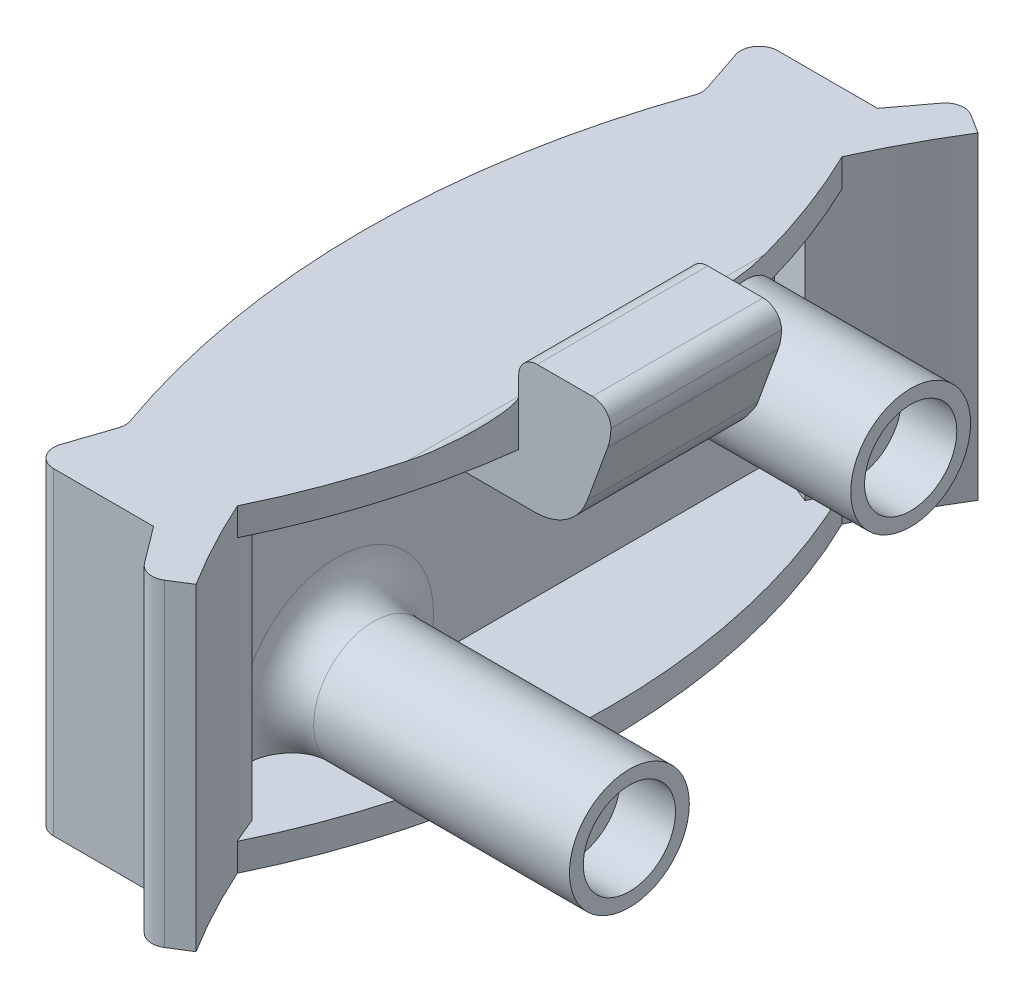
from build123d import *

# Parameters (mm, degrees)
BOSS_EXTRUDE1_DEPTH              = 17.25
CUT_EXTRUDE1_REACH               = 33.729
CUT_EXTRUDE1_END_RADIUS          = 43
SKETCH2_W                        = 9.25
SKETCH2_H                        = 13.25
BOSS_EXTRUDE2_REACH              = 33.729
BOSS_EXTRUDE2_END_RADIUS         = 43
SKETCH4_R                        = 2.5
SKETCH4_R_2                      = 1.6
BOSS_EXTRUDE3_DEPTH              = 1.5
BOSS_EXTRUDE4_START              = -1.5
BOSS_EXTRUDE4_DEPTH              = 1.5
SKETCH9_W                        = 5.001518559
SKETCH9_H                        = 9.25
BOSS_EXTRUDE5_DEPTH              = 3
CHAMFER1_SIZE                    = 2
CHAMFER1_SIZE2                   = 5.494954839
FILLET1_R                        = 3
FILLET2_R                        = 1
FILLET3_R                        = 1
BOSS_EXTRUDE8_REACH              = 55.956
CHAMFER2_START                   = -1
CHAMFER2_DEPTH                   = 19
FILLET5_R                        = 1
BOSS_EXTRUDE9_REACH              = 34.176
BOSS_EXTRUDE10_START             = 1
SKETCH15_R                       = 2.5
SKETCH15_R_2                     = 1.6
BOSS_EXTRUDE10_DEPTH             = 1
BOSS_EXTRUDE11_REACH             = 37.432
SKETCH16_R                       = 3.25
SKETCH16_R_2                     = 2.5
BOSS_EXTRUDE11_DIRECTION_2_DEPTH = 3
FILLET6_R                        = 2
BOSS_EXTRUDE12_START             = -17.25
BOSS_EXTRUDE12_DEPTH             = 17.25
FILLET7_R                        = 1


with BuildPart() as part:
    # Sketch1 → Boss-Extrude1 (new body)
    with BuildSketch(Plane(origin=(0, 0, 0), x_dir=(1, 0, 0), z_dir=(0, 1, 0))):
        with BuildLine():
            ThreePointArc((-42.750548242, 4.625), (-41.193980767, 12.331096812), (-38.260415249, 19.625))
            Line((-38.260415249, 19.625), (-41.603598102, 19.625))
            ThreePointArc((-41.603598102, 19.625), (-46, 0), (-41.603598102, -19.625))
            Line((-41.603598102, -19.625), (-38.260415249, -19.625))
            ThreePointArc((-38.260415249, -19.625), (-41.193980767, -12.331096812), (-42.750548242, -4.625))
            Line((-42.750548242, -4.625), (-28, -4.625))
            Line((-28, -4.625), (-28, 4.625))
            Line((-28, 4.625), (-42.750548242, 4.625))
        make_face()
    extrude(amount=BOSS_EXTRUDE1_DEPTH)

    # Cut-Extrude1: up to this cylinder (the profile starts inside it)
    cut_extrude1_end = Plane(origin=(0, 6.625, 0), z_dir=(0, -1, 0)) * Cylinder(CUT_EXTRUDE1_END_RADIUS, 154.458, mode=Mode.PRIVATE)
    # Sketch2 → Cut-Extrude1 (cut, up to the surface)
    with BuildSketch(Plane(origin=(-28, 0, 0), x_dir=(0, 0, -1), z_dir=(1, 0, 0)), mode=Mode.PRIVATE) as cut_extrude1_sk1:
        with Locations((0, 6.625)):
            Rectangle(SKETCH2_W, SKETCH2_H)
    cut_extrude1_tool1 = extrude(cut_extrude1_sk1.sketch, amount=-CUT_EXTRUDE1_REACH, mode=Mode.PRIVATE) & cut_extrude1_end
    add(cut_extrude1_tool1.solids().sort_by_distance((-28, 6.625, 0))[0], mode=Mode.SUBTRACT)

    # Boss-Extrude2: up to this cylinder (the profile starts inside it)
    boss_extrude2_end = Plane(origin=(0, 8.625, 0), z_dir=(0, -1, 0)) * Cylinder(BOSS_EXTRUDE2_END_RADIUS, 164.708, mode=Mode.PRIVATE)
    # Sketch4 → Boss-Extrude2 (add, up to the surface)
    with BuildSketch(Plane(origin=(-28, 0, 0), x_dir=(0, 0, -1), z_dir=(1, 0, 0)), mode=Mode.PRIVATE) as boss_extrude2_sk1:
        with Locations((-7.625, 3.5)):
            Circle(SKETCH4_R)
        with Locations((-7.625, 3.5)):
            Circle(SKETCH4_R_2, mode=Mode.SUBTRACT)
    boss_extrude2_tool1 = extrude(boss_extrude2_sk1.sketch, amount=-BOSS_EXTRUDE2_REACH, mode=Mode.PRIVATE) & boss_extrude2_end
    add(boss_extrude2_tool1.solids().sort_by_distance((-28, 3.5, 10.054289))[0])
    # Sketch4 → Boss-Extrude2 (add, up to the surface)
    with BuildSketch(Plane(origin=(-28, 0, 0), x_dir=(0, 0, -1), z_dir=(1, 0, 0)), mode=Mode.PRIVATE) as boss_extrude2_sk2:
        with Locations((7.625, 13.75)):
            Circle(SKETCH4_R)
        with Locations((7.625, 13.75)):
            Circle(SKETCH4_R_2, mode=Mode.SUBTRACT)
    boss_extrude2_tool2 = extrude(boss_extrude2_sk2.sketch, amount=-BOSS_EXTRUDE2_REACH, mode=Mode.PRIVATE) & boss_extrude2_end
    add(boss_extrude2_tool2.solids().sort_by_distance((-28, 13.75, -5.195711))[0])

    # Sketch7 → Boss-Extrude3 (add)
    with BuildSketch(Plane.XZ):
        with BuildLine():
            ThreePointArc((-38.260415249, 19.625), (-43, 0), (-38.260415249, -19.625))
            ThreePointArc((-38.260415249, -19.625), (-34.128134601, -10.196688741), (-32.715217313, 0))
            ThreePointArc((-32.715217313, 0), (-34.128134601, 10.196688741), (-38.260415249, 19.625))
        make_face()
    extrude(amount=-BOSS_EXTRUDE3_DEPTH)

    # Sketch8 → Boss-Extrude4 (add)
    with BuildSketch(Plane(origin=(0, 17.25, 0), x_dir=(1, 0, 0), z_dir=(0, 1, 0)).offset(BOSS_EXTRUDE4_START)):
        with BuildLine():
            Line((-42.750548242, 4.625), (-33.001518559, 4.625))
            ThreePointArc((-33.001518559, 4.625), (-34.827078391, 12.406837776), (-38.260415249, 19.625))
            ThreePointArc((-38.260415249, 19.625), (-41.193980767, 12.331096812), (-42.750548242, 4.625))
        make_face()
        with BuildLine():
            ThreePointArc((-38.260415249, -19.625), (-34.827078391, -12.406837776), (-33.001518559, -4.625))
            Line((-33.001518559, -4.625), (-42.750548242, -4.625))
            ThreePointArc((-42.750548242, -4.625), (-41.193980767, -12.331096812), (-38.260415249, -19.625))
        make_face()
    extrude(amount=BOSS_EXTRUDE4_DEPTH)

    # Sketch9 → Boss-Extrude5 (add)
    with BuildSketch(Plane(origin=(0, 17.25, 0), x_dir=(1, 0, 0), z_dir=(0, 1, 0))):
        with Locations((-30.50075928, 0)):
            Rectangle(SKETCH9_W, SKETCH9_H)
    extrude(amount=BOSS_EXTRUDE5_DEPTH)

    # Chamfer1
    chamfer1_edges = [part.edges().sort_by_distance(p)[0] for p in [
        (-28, 13.25, 0),
    ]]
    chamfer1_side = [part.faces().sort_by_distance(p)[0] for p in [
        (-35.458658311, 13.25, 0),
    ]]
    chamfer(chamfer1_edges, length=CHAMFER1_SIZE, length2=CHAMFER1_SIZE2, reference=chamfer1_side[0])

    # Fillet1
    fillet1_edges = [part.edges().sort_by_distance(p)[0] for p in [
        (-28, 18.744954839, 0),
        (-30, 13.25, 0),
    ]]
    fillet(fillet1_edges, radius=FILLET1_R)

    # Fillet2
    fillet2_edges = [part.edges().sort_by_distance(p)[0] for p in [
        (-28, 20.25, 0),
    ]]
    fillet(fillet2_edges, radius=FILLET2_R)

    # Fillet3
    # the kernel refuses this fillet: 1 mm, written as the material it adds along each edge
    with BuildSketch(Plane(origin=(-33.001518559, 17.25, -12.125), x_dir=(0, 1, 0), z_dir=(0, 0, 1))) as fillet3_piece_1_section:
        with BuildLine():
            CenterArc((FILLET3_R, FILLET3_R), FILLET3_R, 180, 90)
            Line((0, FILLET3_R), (0, 0))
            Line((0, 0), (FILLET3_R, 0))
        make_face()
    fillet3_piece_1 = extrude(amount=24.25, mode=Mode.PRIVATE)
    fillet3_piece_1 = fillet3_piece_1 & Plane(origin=(-70.215217313, 17.25, 0), x_dir=(0.8521280550611038, 0, 0.5233333333333359), z_dir=(0, -1, 0)) * Cylinder(37.5, 53, mode=Mode.PRIVATE)
    add(fillet3_piece_1)
    # the kernel refuses this fillet: 1 mm, written as the material it takes off along each edge
    with BuildSketch(Plane(origin=(-33.001518559, 20.25, -7.125), x_dir=(1, 0, 0), z_dir=(0, 0, 1))) as fillet3_2_piece_1:
        with BuildLine():
            CenterArc((FILLET3_R, -FILLET3_R), FILLET3_R, 90, 90)
            Line((0, -FILLET3_R), (0, 0))
            Line((0, 0), (FILLET3_R, 0))
        make_face()
    extrude(amount=14.25, mode=Mode.SUBTRACT)

    # Boss-Extrude8: up to this face of the body (flat: up to its plane)
    boss_extrude8_end = Plane(part.part.faces().sort_by_distance((-39.752003107, 17.25, 0))[0])
    # Sketch12 → Boss-Extrude8 (add, up to the picked face)
    with BuildSketch(Plane.XZ, mode=Mode.PRIVATE) as boss_extrude8_sk1:
        with BuildLine():
            ThreePointArc((-36.466068135, 22.786528362), (-37.39666623, 21.224734507), (-38.260415249, 19.625))
            ThreePointArc((-38.260415249, 19.625), (-37.334080823, 18.029998977), (-36.487295336, 16.391378193))
            ThreePointArc((-36.487295336, 16.391378193), (-35.286505713, 18.837794844), (-33.921923846, 21.196770569))
            Line((-33.921923846, 21.196770569), (-36.466068135, 22.786528362))
        make_face()
    boss_extrude8_tool1 = split(extrude(boss_extrude8_sk1.sketch, amount=-BOSS_EXTRUDE8_REACH, mode=Mode.PRIVATE), bisect_by=boss_extrude8_end, keep=Keep.BOTH, mode=Mode.PRIVATE)
    # Sketch12 → Boss-Extrude8 (add, up to the picked face)
    with BuildSketch(Plane.XZ, mode=Mode.PRIVATE) as boss_extrude8_sk2:
        with BuildLine():
            ThreePointArc((-36.487295336, 16.391378193), (-37.334080823, 18.029998977), (-38.260415249, 19.625))
            ThreePointArc((-38.260415249, 19.625), (-39.104218125, 17.884633763), (-39.868905746, 16.108083517))
            Line((-39.868905746, 16.108083517), (-37.087354183, 14.984263737))
            ThreePointArc((-37.087354183, 14.984263737), (-36.794051907, 15.690689733), (-36.487295336, 16.391378193))
        make_face()
    boss_extrude8_tool2 = split(extrude(boss_extrude8_sk2.sketch, amount=-BOSS_EXTRUDE8_REACH, mode=Mode.PRIVATE), bisect_by=boss_extrude8_end, keep=Keep.BOTH, mode=Mode.PRIVATE)
    # Sketch12 → Boss-Extrude8 (add, up to the picked face)
    with BuildSketch(Plane.XZ, mode=Mode.PRIVATE) as boss_extrude8_sk3:
        with BuildLine():
            Line((-37.087354183, -14.984263737), (-39.868905746, -16.108083517))
            ThreePointArc((-39.868905746, -16.108083517), (-39.104218125, -17.884633763), (-38.260415249, -19.625))
            ThreePointArc((-38.260415249, -19.625), (-37.334080823, -18.029998977), (-36.487295336, -16.391378193))
            ThreePointArc((-36.487295336, -16.391378193), (-36.794051907, -15.690689733), (-37.087354183, -14.984263737))
        make_face()
    boss_extrude8_tool3 = split(extrude(boss_extrude8_sk3.sketch, amount=-BOSS_EXTRUDE8_REACH, mode=Mode.PRIVATE), bisect_by=boss_extrude8_end, keep=Keep.BOTH, mode=Mode.PRIVATE)
    # Sketch12 → Boss-Extrude8 (add, up to the picked face)
    with BuildSketch(Plane.XZ, mode=Mode.PRIVATE) as boss_extrude8_sk4:
        with BuildLine():
            ThreePointArc((-36.487295336, -16.391378193), (-37.334080823, -18.029998977), (-38.260415249, -19.625))
            ThreePointArc((-38.260415249, -19.625), (-37.39666623, -21.224734507), (-36.466068135, -22.786528362))
            Line((-36.466068135, -22.786528362), (-33.921923846, -21.196770569))
            ThreePointArc((-33.921923846, -21.196770569), (-35.286505713, -18.837794844), (-36.487295336, -16.391378193))
        make_face()
    boss_extrude8_tool4 = split(extrude(boss_extrude8_sk4.sketch, amount=-BOSS_EXTRUDE8_REACH, mode=Mode.PRIVATE), bisect_by=boss_extrude8_end, keep=Keep.BOTH, mode=Mode.PRIVATE)
    add(boss_extrude8_tool1.solids().sort_by(Axis((-36.243564, 0, 19.961261), (0, 1, 0)))[0])
    add(boss_extrude8_tool2.solids().sort_by(Axis((-38.098246, 0, 16.960588), (0, 1, 0)))[0])
    add(boss_extrude8_tool3.solids().sort_by(Axis((-38.098246, 0, -16.960588), (0, 1, 0)))[0])
    add(boss_extrude8_tool4.solids().sort_by(Axis((-36.243564, 0, -19.961261), (0, 1, 0)))[0])

    # Chamfer2: read off the stored shape, not the designer's step
    # Chamfer2 outline → Chamfer2 (cut)
    with BuildSketch(Plane(origin=(0, 0, 0), x_dir=(1, 0, 0), z_dir=(0, 1, 0)).offset(CHAMFER2_START)):
        with BuildLine():
            ThreePointArc((-36.466068135, 22.786528362), (-37.39666623, 21.224734507), (-38.260415249, 19.625))
            Line((-38.260415249, 19.625), (-37.795434487, 19.625))
            Line((-37.795434487, 19.625), (-35.755053439, 22.34223707))
            Line((-35.755053439, 22.34223707), (-36.466068135, 22.786528362))
        make_face()
        with BuildLine():
            Line((-37.795434487, -19.625), (-38.260415249, -19.625))
            ThreePointArc((-38.260415249, -19.625), (-37.39666623, -21.224734507), (-36.466068135, -22.786528362))
            Line((-36.466068135, -22.786528362), (-35.755053439, -22.34223707))
            Line((-35.755053439, -22.34223707), (-37.795434487, -19.625))
        make_face()
    extrude(amount=CHAMFER2_DEPTH, mode=Mode.SUBTRACT)

    # Fillet5
    fillet5_edges = [part.edges().sort_by_distance(p)[0] for p in [
        (-35.755053439, 8.625, -22.34223707),
        (-35.755053439, 8.625, 22.34223707),
    ]]
    fillet(fillet5_edges, radius=FILLET5_R)

    # Sketch14 → Boss-Extrude9 (add, up to next)
    with BuildSketch(Plane.ZY.offset(39.868905746), mode=Mode.PRIVATE) as boss_extrude9_sk1:
        with BuildLine():
            Line((-16.108083517, 15.75), (-16.108083517, 1.5))
            Line((-16.108083517, 1.5), (6.125, 1.5))
            ThreePointArc((6.125, 1.5), (7.625, 6), (9.125, 1.5))
            Line((9.125, 1.5), (16.108083517, 1.5))
            Line((16.108083517, 1.5), (16.108083517, 15.75))
            Line((16.108083517, 15.75), (4.625, 15.75))
            Line((4.625, 15.75), (4.625, 13.25))
            Line((4.625, 13.25), (-4.625, 13.25))
            Line((-4.625, 13.25), (-4.625, 15.75))
            Line((-4.625, 15.75), (-6.125, 15.75))
            ThreePointArc((-6.125, 15.75), (-7.625, 11.25), (-9.125, 15.75))
            Line((-9.125, 15.75), (-16.108083517, 15.75))
        make_face()
    boss_extrude9_tool1 = extrude(boss_extrude9_sk1.sketch, amount=BOSS_EXTRUDE9_REACH, mode=Mode.PRIVATE) - part.part
    add(boss_extrude9_tool1.solids().sort_by_distance((-39.868906, 8.284269, 0))[0])

    # Sketch15 → Boss-Extrude10 (add)
    # profile 1 of 2: a face of its own
    with BuildSketch(Plane(origin=(-28, 0, 0), x_dir=(0, 0, -1), z_dir=(1, 0, 0)).offset(BOSS_EXTRUDE10_START)):
        with Locations((-7.625, 3.5)):
            Circle(SKETCH15_R)
        with Locations((-7.625, 3.5)):
            Circle(SKETCH15_R_2, mode=Mode.SUBTRACT)
    # profile 2 of 2: a face of its own
    with BuildSketch(Plane(origin=(-28, 0, 0), x_dir=(0, 0, -1), z_dir=(1, 0, 0)).offset(BOSS_EXTRUDE10_START)):
        with Locations((7.625, 13.75)):
            Circle(SKETCH15_R)
        with Locations((7.625, 13.75)):
            Circle(SKETCH15_R_2, mode=Mode.SUBTRACT)
    extrude(amount=-BOSS_EXTRUDE10_DEPTH)

    # Boss-Extrude11: up to this face of the body (flat: up to its plane)
    boss_extrude11_end = Plane(part.part.faces().sort_by_distance((-39.868905746, 8.284269091, 0))[0])
    # Sketch16 → Boss-Extrude11 (add, up to the picked face)
    with BuildSketch(Plane(origin=(-27, 0, 0), x_dir=(0, 0, -1), z_dir=(1, 0, 0)), mode=Mode.PRIVATE) as boss_extrude11_sk1:
        with Locations(Location((7.625, 13.75, 0), (0, 0, 188.849883098))):
            Circle(SKETCH16_R)
        with Locations((7.625, 13.75)):
            Circle(SKETCH16_R_2, mode=Mode.SUBTRACT)
    boss_extrude11_tool1 = split(extrude(boss_extrude11_sk1.sketch, amount=-BOSS_EXTRUDE11_REACH, mode=Mode.PRIVATE), bisect_by=boss_extrude11_end, keep=Keep.BOTH, mode=Mode.PRIVATE)
    # Sketch16 → Boss-Extrude11 (add, up to the picked face)
    with BuildSketch(Plane(origin=(-27, 0, 0), x_dir=(0, 0, -1), z_dir=(1, 0, 0)), mode=Mode.PRIVATE) as boss_extrude11_sk2:
        with Locations(Location((-7.625, 3.5, 0), (0, 0, 217.979872445))):
            Circle(SKETCH16_R)
        with Locations((-7.625, 3.5)):
            Circle(SKETCH16_R_2, mode=Mode.SUBTRACT)
    boss_extrude11_tool2 = split(extrude(boss_extrude11_sk2.sketch, amount=-BOSS_EXTRUDE11_REACH, mode=Mode.PRIVATE), bisect_by=boss_extrude11_end, keep=Keep.BOTH, mode=Mode.PRIVATE)
    add(boss_extrude11_tool1.solids().sort_by(Axis((-27, 14.235858, -10.745479), (-1, 0, 0)))[0])
    add(boss_extrude11_tool2.solids().sort_by(Axis((-27, 5.443431, 5.135719), (-1, 0, 0)))[0])

    # Sketch16 → Boss-Extrude11 direction 2 (add)
    # profile 1 of 2: a face of its own
    with BuildSketch(Plane(origin=(-27, 0, 0), x_dir=(0, 0, -1), z_dir=(1, 0, 0))):
        with Locations(Location((7.625, 13.75, 0), (0, 0, 188.849883098))):
            Circle(SKETCH16_R)
        with Locations((7.625, 13.75)):
            Circle(SKETCH16_R_2, mode=Mode.SUBTRACT)
    # profile 2 of 2: a face of its own
    with BuildSketch(Plane(origin=(-27, 0, 0), x_dir=(0, 0, -1), z_dir=(1, 0, 0))):
        with Locations(Location((-7.625, 3.5, 0), (0, 0, 217.979872445))):
            Circle(SKETCH16_R)
        with Locations((-7.625, 3.5)):
            Circle(SKETCH16_R_2, mode=Mode.SUBTRACT)
    extrude(amount=BOSS_EXTRUDE11_DIRECTION_2_DEPTH)

    # Fillet6
    fillet6_edges = [part.edges().sort_by_distance(p)[0] for p in [
        (-39.868905746, 10.767632726, -8.916505108),
        (-39.868905746, 6.75, 7.625),
    ]]
    fillet(fillet6_edges, radius=FILLET6_R)

    # Sketch17 → Boss-Extrude12 (add)
    with BuildSketch(Plane(origin=(0, 17.25, 0), x_dir=(1, 0, 0), z_dir=(0, 1, 0)).offset(BOSS_EXTRUDE12_START)):
        with BuildLine():
            ThreePointArc((-43.264990177, 15.625), (-42.481399684, 17.644565195), (-41.603598102, 19.625))
            Line((-41.603598102, 19.625), (-44.603598102, 19.625))
            Line((-44.603598102, 19.625), (-43.264990177, 15.625))
        make_face()
        with BuildLine():
            ThreePointArc((-41.603598102, -19.625), (-42.481399684, -17.644565195), (-43.264990177, -15.625))
            Line((-43.264990177, -15.625), (-44.603598102, -19.625))
            Line((-44.603598102, -19.625), (-41.603598102, -19.625))
        make_face()
    extrude(amount=BOSS_EXTRUDE12_DEPTH)

    # Fillet7
    fillet7_edges = [part.edges().sort_by_distance(p)[0] for p in [
        (-44.603598102, 8.625, -19.625),
        (-43.264990177, 8.625, -15.625),
        (-44.603598102, 8.625, 19.625),
        (-43.264990177, 8.625, 15.625),
    ]]
    fillet(fillet7_edges, radius=FILLET7_R)


solid = part.part
